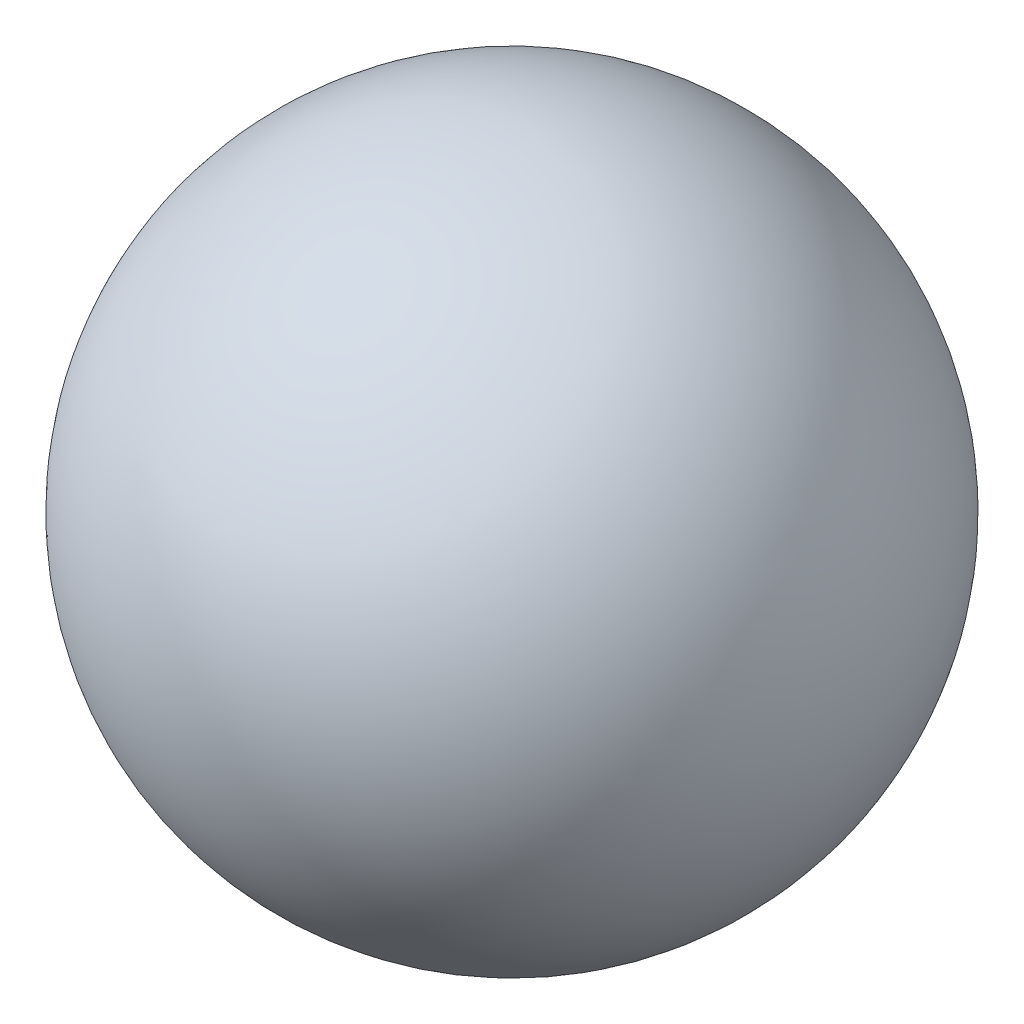
from build123d import *


with BuildPart() as part:
    # 草圖1 → 旋轉5 (revolve)
    with BuildSketch(Plane.XY):
        with BuildLine():
            Line((-35, 0), (35, 0))
            ThreePointArc((35, 0), (0, -35), (-35, 0))
        make_face()
    revolve(axis=Axis((-88.99, 0, 0), (1, 0, 0)))


solid = part.part
